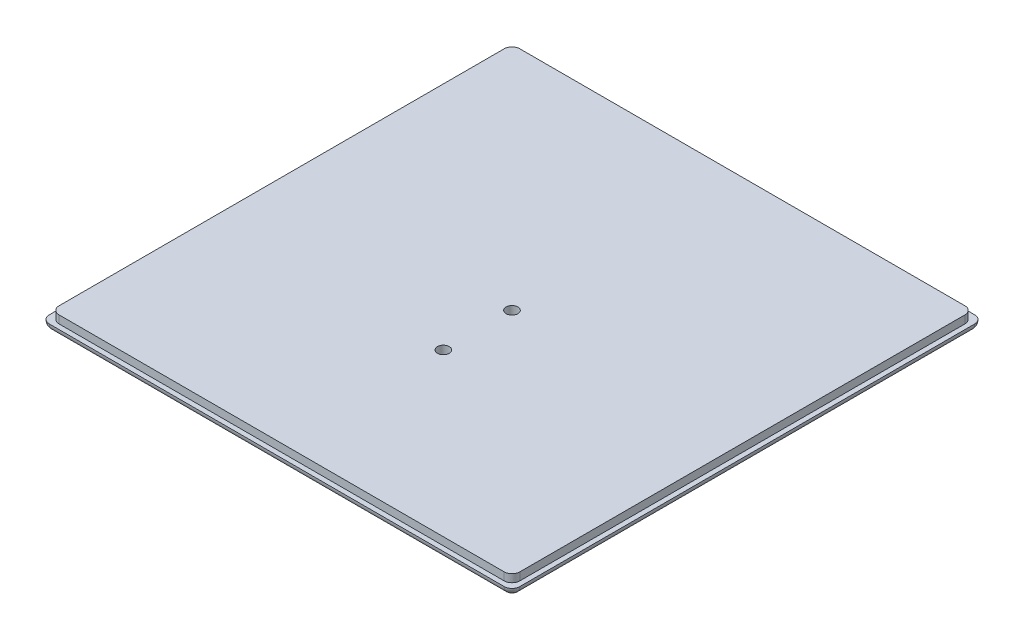
from build123d import *

# Parameters (mm, degrees)
SKETCH1_W           = 120
SKETCH1_H           = 120
BOSS_EXTRUDE1_DEPTH = 2
SKETCH2_W           = 117.5
SKETCH2_H           = 117.5
BOSS_EXTRUDE2_DEPTH = 2
FILLET1_R           = 2
SKETCH4_R           = 1.5
CUT_EXTRUDE1_DEPTH  = 85.947042326


with BuildPart() as part:
    # Sketch1 → Boss-Extrude1 (new body)
    with BuildSketch(Plane(origin=(0, 0, 0), x_dir=(1, 0, 0), z_dir=(0, 1, 0))):
        Rectangle(SKETCH1_W, SKETCH1_H)
    extrude(amount=BOSS_EXTRUDE1_DEPTH)

    # Sketch2 → Boss-Extrude2 (add)
    with BuildSketch(Plane(origin=(0, 2, 0), x_dir=(1, 0, 0), z_dir=(0, 1, 0))):
        Rectangle(SKETCH2_W, SKETCH2_H)
    extrude(amount=BOSS_EXTRUDE2_DEPTH)

    # Fillet1
    fillet1_edges = [part.edges().sort_by_distance(p)[0] for p in [
        (58.75, 3, 58.75),
        (58.75, 3, -58.75),
        (-58.75, 3, -58.75),
        (-58.75, 3, 58.75),
        (0, 0, 60),
        (-60, 0, 0),
        (0, 0, -60),
        (60, 0, 0),
        (60, 1, 60),
        (-60, 1, 60),
        (-60, 1, -60),
        (60, 1, -60),
    ]]
    fillet(fillet1_edges, radius=FILLET1_R - 0.0001)  # a hair under: the kernel refuses the full size

    # Sketch4 → Cut-Extrude1 (cut, through all)
    with BuildSketch(Plane.XZ):
        with Locations(Location((0, 0, 0), (0, 0, 270))):
            Circle(SKETCH4_R)
        with Locations(Location((0, 17.5, 0), (0, 0, 270))):
            Circle(SKETCH4_R)
    extrude(amount=-CUT_EXTRUDE1_DEPTH, mode=Mode.SUBTRACT)


solid = part.part
